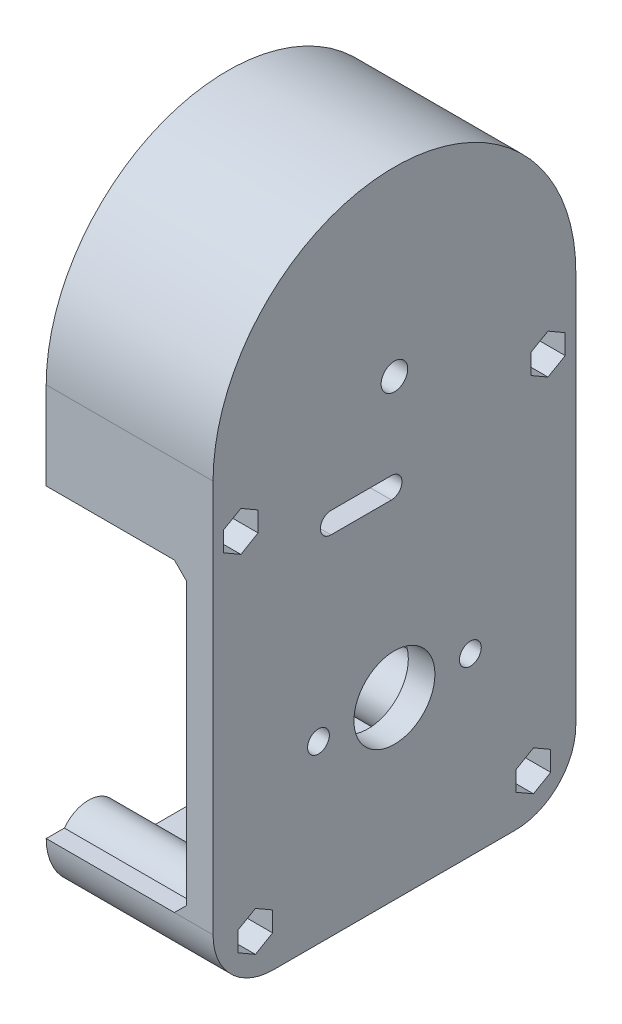
from build123d import *

# Parameters (mm, degrees)
SKETCH1_W           = 60
SKETCH1_H           = 105
BOSS_EXTRUDE1_DEPTH = 4.4
SKETCH2_R           = 2.2
SKETCH2_R_2         = 6.7
SKETCH2_R_3         = 1.8
CUT_EXTRUDE1_DEPTH  = 61.626809251
CUT_EXTRUDE2_DEPTH  = 61.626809251
SKETCH5_R           = 8
SKETCH5_R_2         = 4.25
BOSS_EXTRUDE2_DEPTH = 4.3
CHAMFER1_SIZE       = 1
CUT_EXTRUDE3_DEPTH  = 61.626809251
BOSS_EXTRUDE3_START = 23.2
BOSS_EXTRUDE3_DEPTH = 23.2
SKETCH8_R           = 1.8
CUT_EXTRUDE4_DEPTH  = 67.468112656
FILLET1_R           = 10
BOSS_EXTRUDE4_DEPTH = 23.2
SKETCH11_R          = 1.8
CUT_EXTRUDE6_DEPTH  = 67.468112656
CUT_EXTRUDE5_DEPTH  = 23.6
CHAMFER2_SIZE       = 2


with BuildPart() as part:
    # Sketch1 → Boss-Extrude1 (new body)
    with BuildSketch(Plane(origin=(0, 0, 0), x_dir=(0, 0, -1), z_dir=(1, 0, 0))):
        Rectangle(SKETCH1_W, SKETCH1_H)
    extrude(amount=BOSS_EXTRUDE1_DEPTH)

    # Sketch2 → Cut-Extrude1 (cut, through all)
    with BuildSketch(Plane(origin=(4.4, 0, 0), x_dir=(0, 0, -1), z_dir=(1, 0, 0))):
        with Locations((0, 22.5)):
            Circle(SKETCH2_R)
        with Locations((0, -23.5)):
            Circle(SKETCH2_R_2)
        with Locations((-12.565, -23.5)):
            Circle(SKETCH2_R_3)
        with Locations((12.565, -23.5)):
            Circle(SKETCH2_R_3)
    extrude(amount=-CUT_EXTRUDE1_DEPTH, mode=Mode.SUBTRACT)

    # Sketch4 → Cut-Extrude2 (cut, through all)
    with BuildSketch(Plane(origin=(4.4, 0, 0), x_dir=(0, 0, -1), z_dir=(1, 0, 0))):
        with BuildLine():
            Line((-10.5, 8.55), (-0.5, 8.55))
            ThreePointArc((-0.5, 8.55), (1.25, 6.8), (-0.5, 5.05))
            Line((-0.5, 5.05), (-10.5, 5.05))
            ThreePointArc((-10.5, 5.05), (-12.25, 6.8), (-10.5, 8.55))
        make_face()
    extrude(amount=-CUT_EXTRUDE2_DEPTH, mode=Mode.SUBTRACT)

    # Sketch5 → Boss-Extrude2 (add)
    with BuildSketch(Plane.ZY):
        with Locations(Location((0, 22.5, 0), (0, 0, 180))):
            Circle(SKETCH5_R)
        with Locations(Location((0, 22.5, 0), (0, 0, 180))):
            Circle(SKETCH5_R_2, mode=Mode.SUBTRACT)
    extrude(amount=BOSS_EXTRUDE2_DEPTH)

    # Chamfer1
    chamfer1_edges = [part.edges().sort_by_distance(p)[0] for p in [
        (0, 22.5, 8),
    ]]
    chamfer(chamfer1_edges, length=CHAMFER1_SIZE)

    # Sketch6 → Cut-Extrude3 (cut, through all)
    with BuildSketch(Plane.ZY):
        with BuildLine():
            Line((-30, 52.5), (-30, 22.5))
            ThreePointArc((-30, 22.5), (-21.213203436, 43.713203436), (0, 52.5))
            Line((0, 52.5), (-30, 52.5))
        make_face()
        with BuildLine():
            Line((30, 52.5), (0, 52.5))
            ThreePointArc((0, 52.5), (21.213203436, 43.713203436), (30, 22.5))
            Line((30, 22.5), (30, 52.5))
        make_face()
    extrude(amount=-CUT_EXTRUDE3_DEPTH, mode=Mode.SUBTRACT)

    # Sketch7 → Boss-Extrude3 (add)
    with BuildSketch(Plane.ZY.offset(BOSS_EXTRUDE3_START)):
        with BuildLine():
            Line((-30, 22.5), (-30, 8))
            Line((-30, 8), (-27, 8))
            Line((-27, 8), (-25.4, 8))
            ThreePointArc((-25.4, 8), (-20.4, 13), (-25.4, 18))
            Line((-25.4, 18), (-27, 18))
            Line((-27, 18), (-27, 22.5))
            ThreePointArc((-27, 22.5), (0, 49.5), (27, 22.5))
            Line((27, 22.5), (27, 18))
            Line((27, 18), (25.4, 18))
            ThreePointArc((25.4, 18), (20.4, 13), (25.4, 8))
            Line((25.4, 8), (27, 8))
            Line((27, 8), (30, 8))
            Line((30, 8), (30, 22.5))
            ThreePointArc((30, 22.5), (0, 52.5), (-30, 22.5))
        make_face()
    extrude(amount=-BOSS_EXTRUDE3_DEPTH)

    # Sketch8 → Cut-Extrude4 (cut, through all)
    with BuildSketch(Plane.ZY.offset(23.2)):
        with Locations((-25.4, 13)):
            Circle(SKETCH8_R)
        with Locations((25.4, 13)):
            Circle(SKETCH8_R)
    extrude(amount=-CUT_EXTRUDE4_DEPTH, mode=Mode.SUBTRACT)

    # Fillet1
    fillet1_edges = [part.edges().sort_by_distance(p)[0] for p in [
        (2.2, -52.5, -30),
        (2.2, -52.5, 30),
    ]]
    fillet(fillet1_edges, radius=FILLET1_R)

    # Sketch10 → Boss-Extrude4 (add)
    with BuildSketch(Plane.ZY):
        with BuildLine():
            Line((20, -52.5), (-20, -52.5))
            ThreePointArc((-20, -52.5), (-27.071067812, -49.571067812), (-30, -42.5))
            Line((-30, -42.5), (-27, -42.5))
            ThreePointArc((-27, -42.5), (-19.464466094, -41.964466094), (-20, -49.5))
            Line((-20, -49.5), (20, -49.5))
            ThreePointArc((20, -49.5), (19.464466094, -41.964466094), (27, -42.5))
            Line((27, -42.5), (30, -42.5))
            ThreePointArc((30, -42.5), (27.071067812, -49.571067812), (20, -52.5))
        make_face()
    extrude(amount=BOSS_EXTRUDE4_DEPTH)

    # Sketch11 → Cut-Extrude6 (cut, through all)
    with BuildSketch(Plane.ZY.offset(23.2)):
        with Locations((-23, -45.5)):
            Circle(SKETCH11_R)
        with Locations((23, -45.5)):
            Circle(SKETCH11_R)
    extrude(amount=-CUT_EXTRUDE6_DEPTH, mode=Mode.SUBTRACT)

    # Sketch9 → Cut-Extrude5 (cut)
    with BuildSketch(Plane(origin=(4.4, 0, 0), x_dir=(0, 0, -1), z_dir=(1, 0, 0))):
        Polygon((-25.4, 9.709103466), (-22.55, 11.354551733), (-22.55, 14.645448267), (-25.4, 16.290896534), (-28.25, 14.645448267), (-28.25, 11.354551733), align=None)
        Polygon((25.4, 9.709103466), (28.25, 11.354551733), (28.25, 14.645448267), (25.4, 16.290896534), (22.55, 14.645448267), (22.55, 11.354551733), align=None)
        Polygon((-23, -42.209103466), (-25.85, -43.854551733), (-25.85, -47.145448267), (-23, -48.790896534), (-20.15, -47.145448267), (-20.15, -43.854551733), align=None)
        Polygon((23, -48.790896534), (25.85, -47.145448267), (25.85, -43.854551733), (23, -42.209103466), (20.15, -43.854551733), (20.15, -47.145448267), align=None)
    extrude(amount=-CUT_EXTRUDE5_DEPTH, mode=Mode.SUBTRACT)

    # Chamfer2
    # the kernel refuses this chamfer: 2 mm, written as the material it adds along each edge
    with BuildSketch(Plane(origin=(0, 12.856634024, -27), x_dir=(0.02749587661058639, 0, 0.9996219169112968), z_dir=(0, 1, 0))) as chamfer2_piece_1_section:
        Polygon((CHAMFER2_SIZE * 0.999621916911, -CHAMFER2_SIZE * 0.0274958766106), (-CHAMFER2_SIZE * 0.0274958766106, -CHAMFER2_SIZE * 0.999621916911), (0, 0), align=None)
    chamfer2_piece_1 = extrude(amount=9.643365976, mode=Mode.PRIVATE)
    chamfer2_piece_1 = split(chamfer2_piece_1, bisect_by=Plane(origin=(-0.079985343, 16.613435796, -25.958654389), z_dir=(0, 0.866025403784439, 0.4999999999999995)), keep=Keep.TOP, mode=Mode.PRIVATE)
    add(chamfer2_piece_1)
    with BuildSketch(Plane(origin=(0, 22.5, 27), x_dir=(0.02749587661058639, 0, -0.9996219169112968), z_dir=(0, -1, 0))) as chamfer2_piece_2_section:
        Polygon((CHAMFER2_SIZE * 0.999621916911, -CHAMFER2_SIZE * 0.0274958766106), (-CHAMFER2_SIZE * 0.0274958766106, -CHAMFER2_SIZE * 0.999621916911), (0, 0), align=None)
    chamfer2_piece_2 = extrude(amount=9.643365976, mode=Mode.PRIVATE)
    chamfer2_piece_2 = split(chamfer2_piece_2, bisect_by=Plane(origin=(-0.629221359, 16.946033943, 24.265268722), z_dir=(0, 0.8660254037844389, 0.4999999999999995)), keep=Keep.TOP, mode=Mode.PRIVATE)
    add(chamfer2_piece_2)
    with BuildSketch(Plane(origin=(0, 22.5, 0), x_dir=(0, 0, -1), z_dir=(0, -1, 0))) as chamfer2_piece_3:
        Polygon((27 - CHAMFER2_SIZE, 0), (27, -CHAMFER2_SIZE), (27, 0), align=None)
    revolve(axis=Axis((0, 22.5, 0), (1, 0, 0)), revolution_arc=180)
    with BuildSketch(Plane(origin=(0, 13, 25.4), x_dir=(0, 1, 0), z_dir=(0, 0, 1))) as chamfer2_piece_4:
        Polygon((5 + CHAMFER2_SIZE, 0), (5, CHAMFER2_SIZE), (5, 0), align=None)
    revolve(axis=Axis((0, 13, 25.4), (-1, 0, 0)), revolution_arc=180)
    with BuildSketch(Plane(origin=(0, 8, 25.4), x_dir=(0.027495876610586365, -0.9996219169112968, 0), z_dir=(0, 0, 1)), Plane(origin=(0, 8, -30), x_dir=(0.027495876610586365, -0.9996219169112968, 0), z_dir=(0, 0, 1))) as chamfer2_piece_5:
        Polygon((CHAMFER2_SIZE * 0.999621916911, -CHAMFER2_SIZE * 0.0274958766106), (-CHAMFER2_SIZE * 0.0274958766106, -CHAMFER2_SIZE * 0.999621916911), (0, 0), align=None)
    extrude(amount=4.6)
    with BuildSketch(Plane(origin=(0, 13, -25.4), x_dir=(0, -1, 0), z_dir=(0, 0, -1))) as chamfer2_piece_6:
        Polygon((5 + CHAMFER2_SIZE, 0), (5, CHAMFER2_SIZE), (5, 0), align=None)
    revolve(axis=Axis((0, 13, -25.4), (-1, 0, 0)), revolution_arc=180)
    with BuildSketch(Plane(origin=(0, -42.5, -30), x_dir=(0.02749587661058639, 0.9996219169112968, 0), z_dir=(0, 0, 1))) as chamfer2_piece_7_section:
        Polygon((CHAMFER2_SIZE * 0.999621916911, CHAMFER2_SIZE * 0.0274958766106), (-CHAMFER2_SIZE * 0.0274958766106, CHAMFER2_SIZE * 0.999621916911), (0, 0), align=None)
    chamfer2_piece_7 = extrude(amount=8.143365976, mode=Mode.PRIVATE)
    chamfer2_piece_7 = split(chamfer2_piece_7, bisect_by=Plane(origin=(-0.399536962, -44.995246479, -27.825741256), z_dir=(0, 0.8660254037844387, -0.4999999999999999)), keep=Keep.TOP, mode=Mode.PRIVATE)
    add(chamfer2_piece_7)
    with BuildSketch(Plane(origin=(0, -42.5, 21.856634024), x_dir=(0.02749587661058639, 0.9996219169112968, 0), z_dir=(0, 0, 1))) as chamfer2_piece_8_section:
        Polygon((CHAMFER2_SIZE * 0.999621916911, CHAMFER2_SIZE * 0.0274958766106), (-CHAMFER2_SIZE * 0.0274958766106, CHAMFER2_SIZE * 0.999621916911), (0, 0), align=None)
    chamfer2_piece_8 = extrude(amount=8.143365976, mode=Mode.PRIVATE)
    chamfer2_piece_8 = split(chamfer2_piece_8, bisect_by=Plane(origin=(-0.031503092, -41.384608505, 21.571932838), z_dir=(0, 0.8660254037844383, 0.5000000000000008)), keep=Keep.TOP, mode=Mode.PRIVATE)
    add(chamfer2_piece_8)
    with BuildSketch(Plane(origin=(0, -45.5, 23), x_dir=(0, -0.9259929219168064, 0.37754087005246884), z_dir=(0, 0.37754087005246884, 0.9259929219168064))) as chamfer2_piece_9_section:
        Polygon((5 + CHAMFER2_SIZE, 0), (5, -CHAMFER2_SIZE), (5, 0), align=None)
    chamfer2_piece_9 = revolve(axis=Axis((0, -45.5, 23), (1, 0, 0)), revolution_arc=314.36288287, mode=Mode.PRIVATE)
    chamfer2_piece_9 = chamfer2_piece_9 & Plane(origin=(-0.670588615, -42.5, 20), x_dir=(0, 0, 1), z_dir=(1, 0, 0)) * Cylinder(10, 28, mode=Mode.PRIVATE)
    add(chamfer2_piece_9)
    with BuildSketch(Plane(origin=(0, -45.5, -23), x_dir=(0, -0.3775408700524707, -0.9259929219168057), z_dir=(0, -0.9259929219168057, 0.3775408700524707))) as chamfer2_piece_10_section:
        Polygon((5 + CHAMFER2_SIZE, 0), (5, -CHAMFER2_SIZE), (5, 0), align=None)
    chamfer2_piece_10 = revolve(axis=Axis((0, -45.5, -23), (1, 0, 0)), revolution_arc=314.36288287, mode=Mode.PRIVATE)
    chamfer2_piece_10 = chamfer2_piece_10 & Plane(origin=(-0.979908178, -42.5, -20), x_dir=(0, -1, 0), z_dir=(1, 0, 0)) * Cylinder(10, 28, mode=Mode.PRIVATE)
    add(chamfer2_piece_10)
    with BuildSketch(Plane(origin=(0, -49.5, -25.143365976), x_dir=(0.02749587661058639, 0.9996219169112968, 0), z_dir=(0, 0, 1))) as chamfer2_piece_11_section:
        Polygon((CHAMFER2_SIZE * 0.999621916911, CHAMFER2_SIZE * 0.0274958766106), (-CHAMFER2_SIZE * 0.0274958766106, CHAMFER2_SIZE * 0.999621916911), (0, 0), align=None)
    chamfer2_piece_11 = extrude(amount=50.286731952, mode=Mode.PRIVATE)
    chamfer2_piece_11 = split(chamfer2_piece_11, bisect_by=Plane(origin=(-0.67159105, -38.844675798, 5.772640341), z_dir=(0, -0.8660254037844397, -0.4999999999999982)), keep=Keep.TOP, mode=Mode.PRIVATE)
    chamfer2_piece_11 = split(chamfer2_piece_11, bisect_by=Plane(origin=(-0.67159105, -38.844675769, -5.77264029), z_dir=(0, -0.8660254037844408, 0.4999999999999964)), keep=Keep.TOP, mode=Mode.PRIVATE)
    add(chamfer2_piece_11)
    with BuildSketch(Plane(origin=(0, 18, -25.4), x_dir=(0.02749587661058639, 0.9996219169112968, 0), z_dir=(0, 0, -1))) as chamfer2_piece_12_section:
        Polygon((CHAMFER2_SIZE * 0.999621916911, -CHAMFER2_SIZE * 0.0274958766106), (-CHAMFER2_SIZE * 0.0274958766106, -CHAMFER2_SIZE * 0.999621916911), (0, 0), align=None)
    chamfer2_piece_12 = extrude(amount=6.743365976, mode=Mode.PRIVATE)
    chamfer2_piece_12 = split(chamfer2_piece_12, bisect_by=Plane(origin=(-0.666666667, 18.666666667, -30), z_dir=(0, 0, 1)), keep=Keep.TOP, mode=Mode.PRIVATE)
    add(chamfer2_piece_12)
    with BuildSketch(Plane(origin=(0, 18, 27), x_dir=(0.02749587661058639, 0.9996219169112968, 0), z_dir=(0, 0, -1))) as chamfer2_piece_13:
        Polygon((CHAMFER2_SIZE * 0.999621916911, -CHAMFER2_SIZE * 0.0274958766106), (-CHAMFER2_SIZE * 0.0274958766106, -CHAMFER2_SIZE * 0.999621916911), (0, 0), align=None)
    extrude(amount=1.6)


solid = part.part
